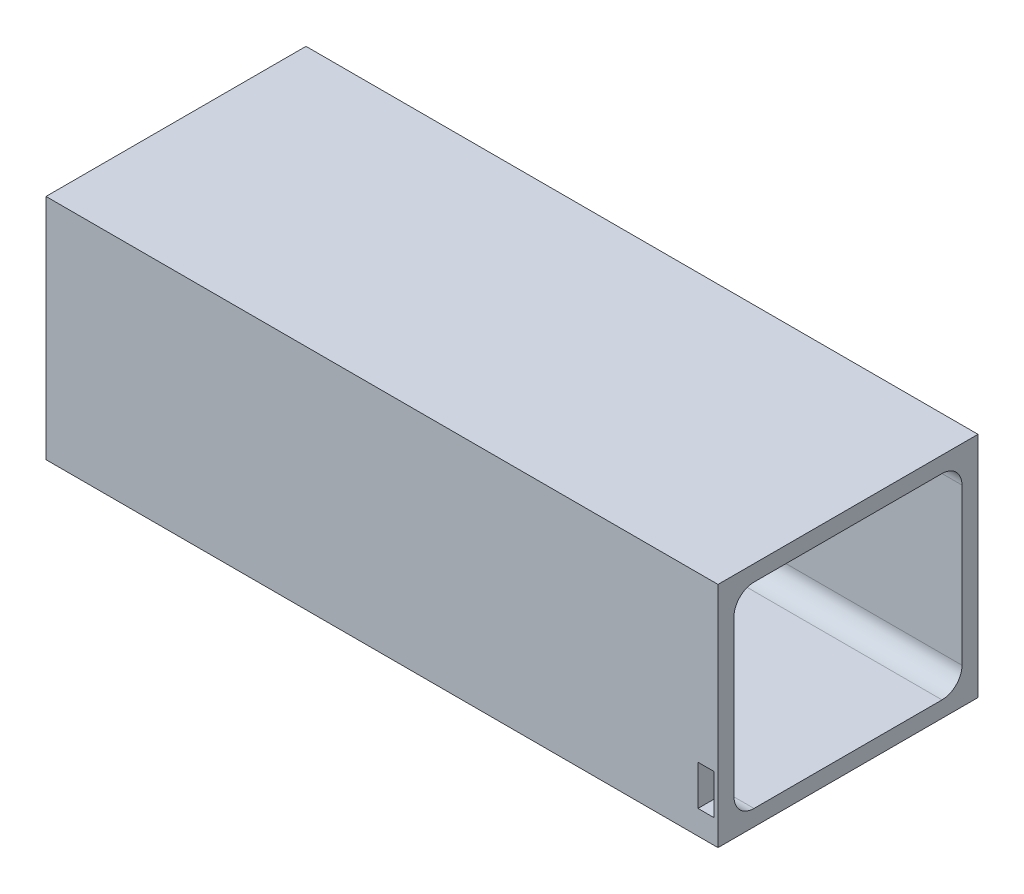
from build123d import *

# Parameters (mm, degrees)
SKETCH_1_W          = 65
SKETCH_1_H          = 57
EXTRUDE_1_DEPTH     = 167
SKETCH_2_W          = 4
SKETCH_2_H          = 10
CUT_EXTRUDE_1_DEPTH = 10
SKETCH_3_W          = 65
SKETCH_3_H          = 57
EXTRUDE_2_DEPTH     = 1


with BuildPart() as part:
    # Эскиз1 → Бобышка-Вытянуть1 (new body)
    with BuildSketch(Plane(origin=(0, 0, 0), x_dir=(0, 0, -1), z_dir=(1, 0, 0))):
        Rectangle(SKETCH_1_W, SKETCH_1_H)
        with BuildLine():
            Line((23.5, -24.5), (-23.5, -24.5))
            ThreePointArc((-23.5, -24.5), (-27.035533906, -23.035533906), (-28.5, -19.5))
            Line((-28.5, -19.5), (-28.5, 19.5))
            ThreePointArc((-28.5, 19.5), (-27.035533906, 23.035533906), (-23.5, 24.5))
            Line((-23.5, 24.5), (23.5, 24.5))
            ThreePointArc((23.5, 24.5), (27.035533906, 23.035533906), (28.5, 19.5))
            Line((28.5, 19.5), (28.5, -19.5))
            ThreePointArc((28.5, -19.5), (27.035533906, -23.035533906), (23.5, -24.5))
        make_face(mode=Mode.SUBTRACT)
    extrude(amount=-EXTRUDE_1_DEPTH)

    # Эскиз2 → Вырез-Вытянуть1 (cut)
    with BuildSketch(Plane.XY.offset(32.5)):
        with Locations((-3, -17.5)):
            Rectangle(SKETCH_2_W, SKETCH_2_H)
    extrude(amount=-CUT_EXTRUDE_1_DEPTH, mode=Mode.SUBTRACT)

    # Эскиз3 → Бобышка-Вытянуть2 (add)
    with BuildSketch(Plane.ZY.offset(167)):
        Rectangle(SKETCH_3_W, SKETCH_3_H)
    extrude(amount=EXTRUDE_2_DEPTH)


solid = part.part
